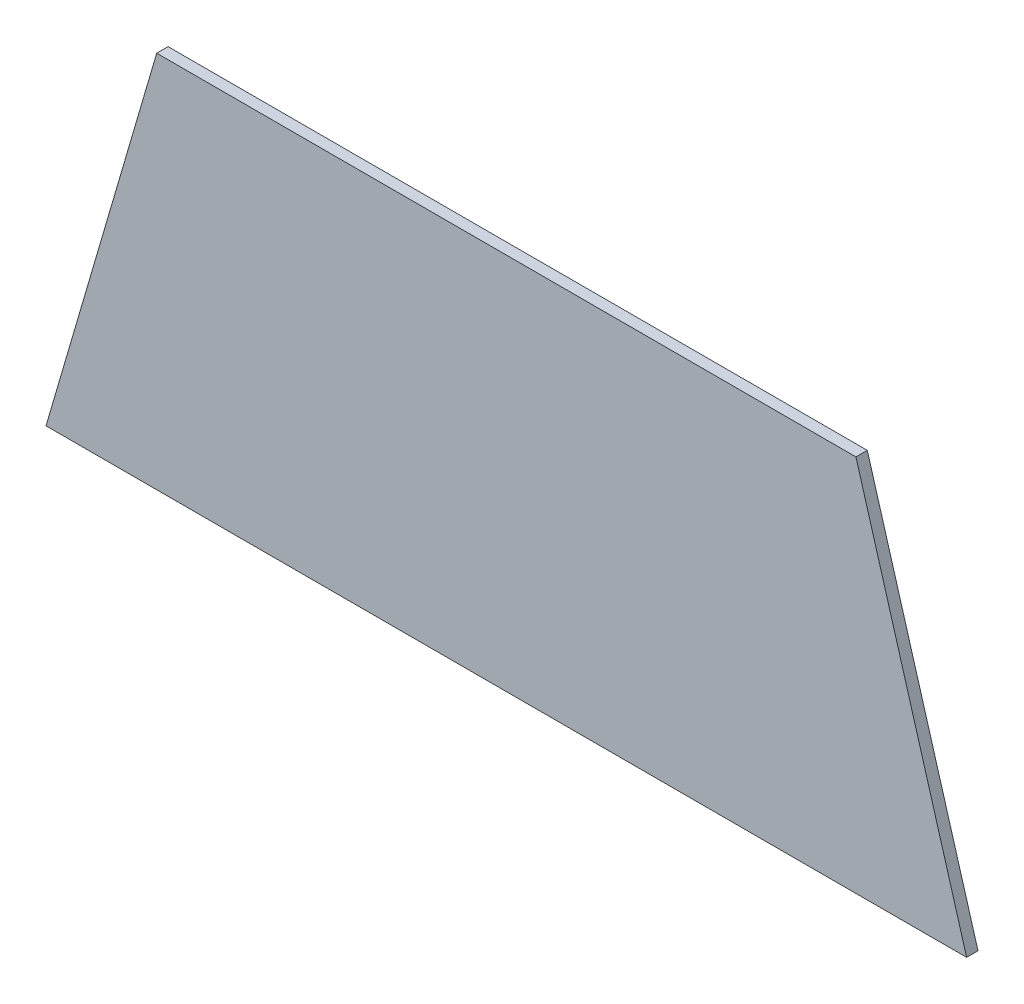
from build123d import *

# Parameters (mm, degrees)
BOSS_EXTRUDE1_DEPTH      = 3
BOSS_EXTRUDE1_DEPTH_BACK = 0.006725904


with BuildPart() as part:
    # Sketch1 → Boss-Extrude1 (new, two sides: drawn at the far end of the back side and taken through both)
    with BuildSketch(Plane.XY.offset(-BOSS_EXTRUDE1_DEPTH_BACK)):
        Polygon((1.5, 0), (245, 0), (215.720058283, 100), (30.779941717, 100), align=None)
    extrude(amount=BOSS_EXTRUDE1_DEPTH + BOSS_EXTRUDE1_DEPTH_BACK)


solid = part.part
